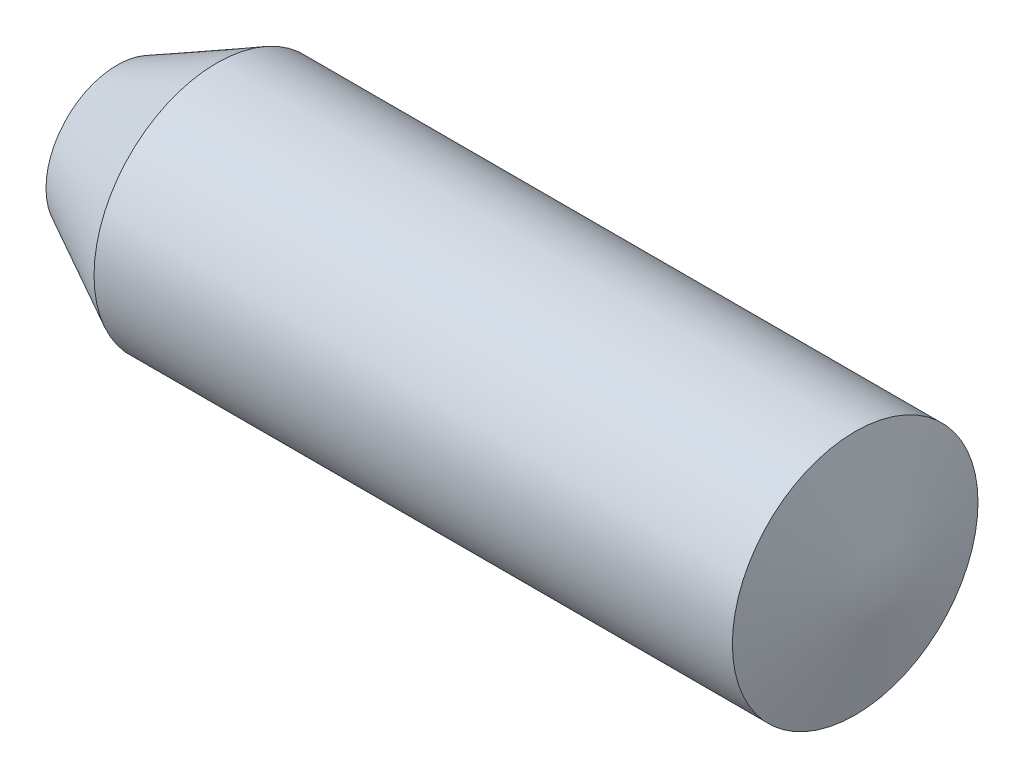
from build123d import *


with BuildPart() as part:
    # Sketch1 → Revolve1 (revolve)
    with BuildSketch(Plane.XY):
        Polygon((0, 0), (0, 169.096871333), (237.245718475, 292.1), (1755.508482821, 292.1), (1828.8, 0), align=None)
    revolve(axis=Axis((0, 0, 0), (1, 0, 0)))


solid = part.part
